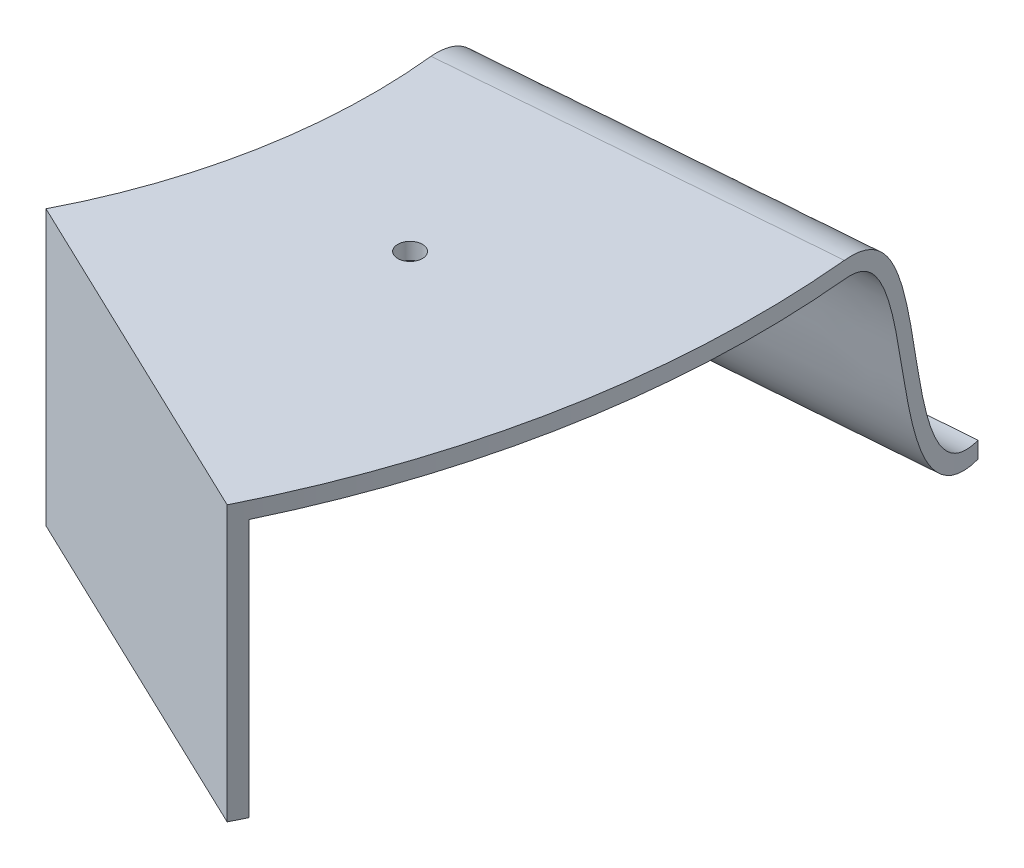
from build123d import *

# Parameters (mm, degrees)
SKETCH2_R                 = 178
SKETCH2_R_2               = 100
BOSS_EXTRUDE1_DEPTH       = 3
SKETCH3_R                 = 178
SKETCH3_R_2               = 175
BOSS_EXTRUDE2_DEPTH       = 60
CUT_EXTRUDE2_START        = -25
CUT_EXTRUDE2_DEPTH        = 25
BOSS_EXTRUDE4_START       = -50
BOSS_EXTRUDE4_DEPTH       = 50
BOSS_EXTRUDE5_START       = 3
BOSS_EXTRUDE5_DEPTH       = 3
BOSS_EXTRUDE15_REACH      = 346.25
BOSS_EXTRUDE15_END_RADIUS = 175
BOSS_EXTRUDE16_REACH      = 263.713
SKETCH15_W                = 3.001191186
SKETCH15_H                = 49
FILLET2_START             = 104.957134107
FILLET2_DEPTH             = 3.001191186
SKETCH16_R                = 178
CUT_EXTRUDE3_DEPTH        = 73
CUT_EXTRUDE4_REACH        = 200.073
SKETCH17_R                = 2.25


with BuildPart() as part:
    # Sketch2 → Boss-Extrude1 (new body)
    with BuildSketch(Plane(origin=(0, 0, 0), x_dir=(1, 0, 0), z_dir=(0, 1, 0))):
        with Locations(Location((0, 0, 0), (0, 0, 270))):
            Circle(SKETCH2_R)
        with Locations(Location((0, 0, 0), (0, 0, 270))):
            Circle(SKETCH2_R_2, mode=Mode.SUBTRACT)
    extrude(amount=BOSS_EXTRUDE1_DEPTH)

    # Sketch3 → Boss-Extrude2 (add)
    with BuildSketch(Plane(origin=(0, 3, 0), x_dir=(1, 0, 0), z_dir=(0, 1, 0))):
        with Locations(Location((0, 0, 0), (0, 0, 270))):
            Circle(SKETCH3_R)
        with Locations(Location((0, 0, 0), (0, 0, 270))):
            Circle(SKETCH3_R_2, mode=Mode.SUBTRACT)
    extrude(amount=BOSS_EXTRUDE2_DEPTH)

    # Sketch5 → Cut-Extrude2 (cut)
    with BuildSketch(Plane(origin=(0, 3, 0), x_dir=(1, 0, 0), z_dir=(0, 1, 0)).offset(CUT_EXTRUDE2_START)):
        with BuildLine():
            Line((174.470835958, 13.59880142), (99.697620548, 7.770743669))
            ThreePointArc((99.697620548, 7.770743669), (99.924376542, 3.888312311), (100, 0))
            ThreePointArc((100, 0), (97.525905257, -22.106510438), (90.226043925, -43.11914885))
            Line((90.226043925, -43.11914885), (157.895576869, -75.458510488))
            ThreePointArc((157.895576869, -75.458510488), (170.6703342, -38.686393266), (175, 0))
            ThreePointArc((175, 0), (174.867658949, 6.804546543), (174.470835958, 13.59880142))
        make_face()
    extrude(amount=CUT_EXTRUDE2_DEPTH, mode=Mode.SUBTRACT)

    # Sketch16 → Cut-Extrude3 (cut)
    with BuildSketch(Plane(origin=(0, -10, 0), x_dir=(1, 0, 0), z_dir=(0, 1, 0))):
        Circle(SKETCH16_R)
    extrude(amount=CUT_EXTRUDE3_DEPTH, mode=Mode.SUBTRACT)


with BuildPart() as body_2:
    # Sketch8 → Boss-Extrude4 (new body)
    with BuildSketch(Plane(origin=(0, -10, 0), x_dir=(1, 0, 0), z_dir=(0, 1, 0)).offset(BOSS_EXTRUDE4_START)):
        with BuildLine():
            Line((157.895576869, -75.458510488), (97.444127439, -46.568680758))
            ThreePointArc((97.444127439, -46.568680758), (98.081576263, -45.210666859), (98.700100465, -43.843929662))
            ThreePointArc((98.700100465, -43.843929662), (106.176660799, -19.761495426), (107.86500381, 5.398236111))
            ThreePointArc((107.86500381, 5.398236111), (107.779614919, 6.895984919), (107.673430191, 8.392403162))
            ThreePointArc((107.673430191, 8.392403162), (107.546470116, 9.88720211), (107.39875919, 11.380093344))
            Line((107.39875919, 11.380093344), (104.40664299, 11.14687847))
            ThreePointArc((104.40664299, 11.14687847), (103.227309111, -19.212564998), (93.405095457, -47.963404203))
            Line((93.405095457, -47.963404203), (156.578799716, -78.15420321))
            ThreePointArc((156.578799716, -78.15420321), (157.242965096, -76.80917867), (157.895576869, -75.458510488))
        make_face()
    extrude(amount=BOSS_EXTRUDE4_DEPTH)

    # Sketch9 → Boss-Extrude5 (add)
    with BuildSketch(Plane(origin=(0, -10, 0), x_dir=(-1, 0, 0), z_dir=(0, -1, 0)).offset(BOSS_EXTRUDE5_START)):
        with BuildLine():
            ThreePointArc((-93.405095457, -47.963404203), (-103.227309111, -19.212564998), (-104.40664299, 11.14687847))
            Line((-104.40664299, 11.14687847), (-174.212075233, 16.587731699))
            ThreePointArc((-174.212075233, 16.587731699), (-172.045515184, -32.020941663), (-156.578799716, -78.15420321))
            Line((-156.578799716, -78.15420321), (-93.405095457, -47.963404203))
        make_face()
    extrude(amount=-BOSS_EXTRUDE5_DEPTH)


with BuildPart() as body_3:
    # Boss-Extrude15: up to this cylinder (the profile starts inside it)
    boss_extrude15_end = Plane(origin=(0, -35.052685, 0), z_dir=(0, -1, 0)) * Cylinder(BOSS_EXTRUDE15_END_RADIUS, 1043.5, mode=Mode.PRIVATE)
    # Sketch14 → Boss-Extrude15 (new, up to the surface)
    with BuildSketch(Plane(origin=(104.6397653, 0, -8.155949853), x_dir=(0, 1, 0), z_dir=(0.9969762054751131, 0, -0.07770743668687732)), mode=Mode.PRIVATE) as boss_extrude15_sk1:
        with BuildLine():
            Line((-56, -33.149626863), (-59, -33.149626863))
            add(Edge.make_bspline(
                [(-13, -3), (-13, -3.252742632), (-13.017835017, -3.772139773), (-13.118535688, -4.696081698), (-13.354753506, -5.728289796), (-13.790711815, -6.796346653), (-14.57235228, -8.073596542), (-15.969031451, -9.501150583), (-18.417965946, -11.02187183), (-21.560218655, -12.309547439), (-26.464579206, -13.73861764), (-33.523749843, -15.121678766), (-42.302010507, -16.833830818), (-49.062318848, -19.008877457), (-53.702980916, -21.83051429), (-56.611293913, -24.732512094), (-58.237380526, -27.905736518), (-58.80960896, -30.443459169), (-58.972930909, -31.962804263), (-59, -32.756631085), (-59, -33.149626863)],
                knots=[0, 0, 0, 0, 0.015625, 0.03125, 0.0625, 0.09375, 0.125, 0.1875, 0.25, 0.3125, 0.375, 0.5, 0.625, 0.75, 0.8125, 0.875, 0.9375, 0.96875, 0.984375, 1, 1, 1, 1], degree=3))
            Line((-13, -3), (-10, -3))
            add(Edge.make_bspline(
                [(-10, -3), (-10, -24.167074489), (-56, -11.982552374), (-56, -33.149626863)],
                knots=[0, 0, 0, 0, 1, 1, 1, 1], degree=3))
        make_face()
    boss_extrude15_tool1 = extrude(boss_extrude15_sk1.sketch, amount=BOSS_EXTRUDE15_REACH, mode=Mode.PRIVATE) & boss_extrude15_end
    add(boss_extrude15_tool1.solids().sort_by_distance((103.281222, -35.052685, -25.585884))[0])

    # Sketch15 → Boss-Extrude16 (add, up to next)
    with BuildSketch(Plane(origin=(-0.23312231, 0, -2.990928616), x_dir=(-0.9969762054751131, 0, 0.07770743668687734), z_dir=(-0.07770743668687734, 0, -0.9969762054751131)), mode=Mode.PRIVATE) as boss_extrude16_sk1:
        with Locations((-106.4577297, -34.5)):
            Rectangle(SKETCH15_W, SKETCH15_H)
    boss_extrude16_tool1 = extrude(boss_extrude16_sk1.sketch, amount=BOSS_EXTRUDE16_REACH, mode=Mode.PRIVATE) - body_3.part

    add(body_2.part)  # Boss-Extrude16 merges body 2
    add(boss_extrude16_tool1.solids().sort_by_distance((105.902701, -34.5, -11.263486))[0])

    # Fillet2: read off the stored shape, not the designer's step
    # Fillet2 outline → Fillet2 (add)
    with BuildSketch(Plane(origin=(0, 0, 0), x_dir=(0, 1, 0), z_dir=(0.9969762054751131, 0, -0.07770743668687731)).offset(FILLET2_START)):
        with BuildLine():
            Line((-59, -3), (-60, -3))
            ThreePointArc((-60, -3), (-59.253205655, -5.122830966), (-59, -7.358898944))
            Line((-59, -7.358898944), (-59, -3))
        make_face()
    extrude(amount=FILLET2_DEPTH)

    # Sketch17 → Cut-Extrude4 (cut, up to next)
    with BuildSketch(Plane(origin=(0, -10, 0), x_dir=(1, 0, 0), z_dir=(0, 1, 0)), mode=Mode.PRIVATE) as cut_extrude4_sk1:
        with Locations(Location((133.270755038, -21.538473754, 0), (0, 0, 270))):
            Circle(SKETCH17_R)
    cut_extrude4_tool1 = extrude(cut_extrude4_sk1.sketch, amount=-CUT_EXTRUDE4_REACH, mode=Mode.PRIVATE) & body_3.part
    add(cut_extrude4_tool1.solids().sort_by_distance((133.270755, -10, 21.538474))[0], mode=Mode.SUBTRACT)


solid = body_3.part
